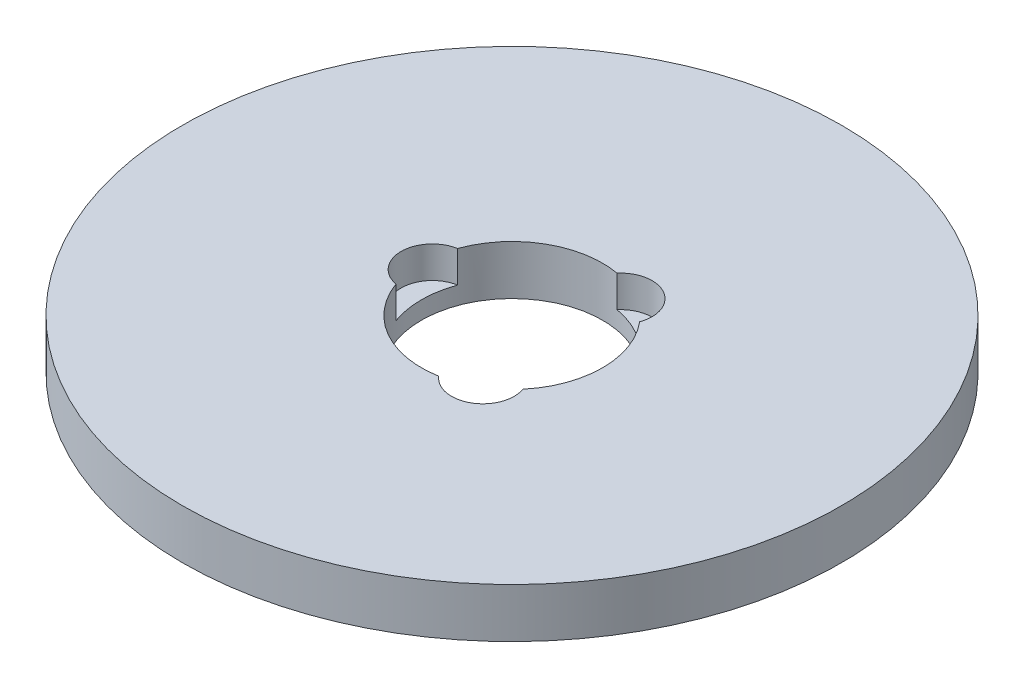
from build123d import *

# Parameters (mm, degrees)
SKETCH1_R           = 100
BOSS_EXTRUDE1_DEPTH = 15
SKETCH2_R           = 27.5
CUT_EXTRUDE1_DEPTH  = 143.214626533
SKETCH3_R           = 9.509125407
CUT_EXTRUDE2_DEPTH  = 9.619313814
CIRPATTERN1_COUNT   = 3


with BuildPart() as part:
    # Sketch1 → Boss-Extrude1 (new body)
    with BuildSketch(Plane(origin=(0, 0, 0), x_dir=(1, 0, 0), z_dir=(0, 1, 0))):
        Circle(SKETCH1_R)
    extrude(amount=BOSS_EXTRUDE1_DEPTH)

    # Sketch2 → Cut-Extrude1 (cut, through all)
    with BuildSketch(Plane(origin=(0, 0, 0), x_dir=(1, 0, 0), z_dir=(0, 1, 0))):
        Circle(SKETCH2_R)
    extrude(amount=CUT_EXTRUDE1_DEPTH, mode=Mode.SUBTRACT)

    # Sketch3 → Cut-Extrude2 (cut)
    with BuildSketch(Plane(origin=(0, 15, 0), x_dir=(1, 0, 0), z_dir=(0, 1, 0))):
        with Locations((-24.152655471, 0)):
            Circle(SKETCH3_R)
    cut_extrude2 = extrude(amount=-CUT_EXTRUDE2_DEPTH, mode=Mode.SUBTRACT)

    # CirPattern1: Cut-Extrude2 ×3 about axis
    cirpattern1_axis = Axis((0, 0, 0), (0, 1, 0))
    for i in range(1, CIRPATTERN1_COUNT):
        add(cut_extrude2.rotate(cirpattern1_axis, i * 360 / CIRPATTERN1_COUNT), mode=Mode.SUBTRACT)


solid = part.part
